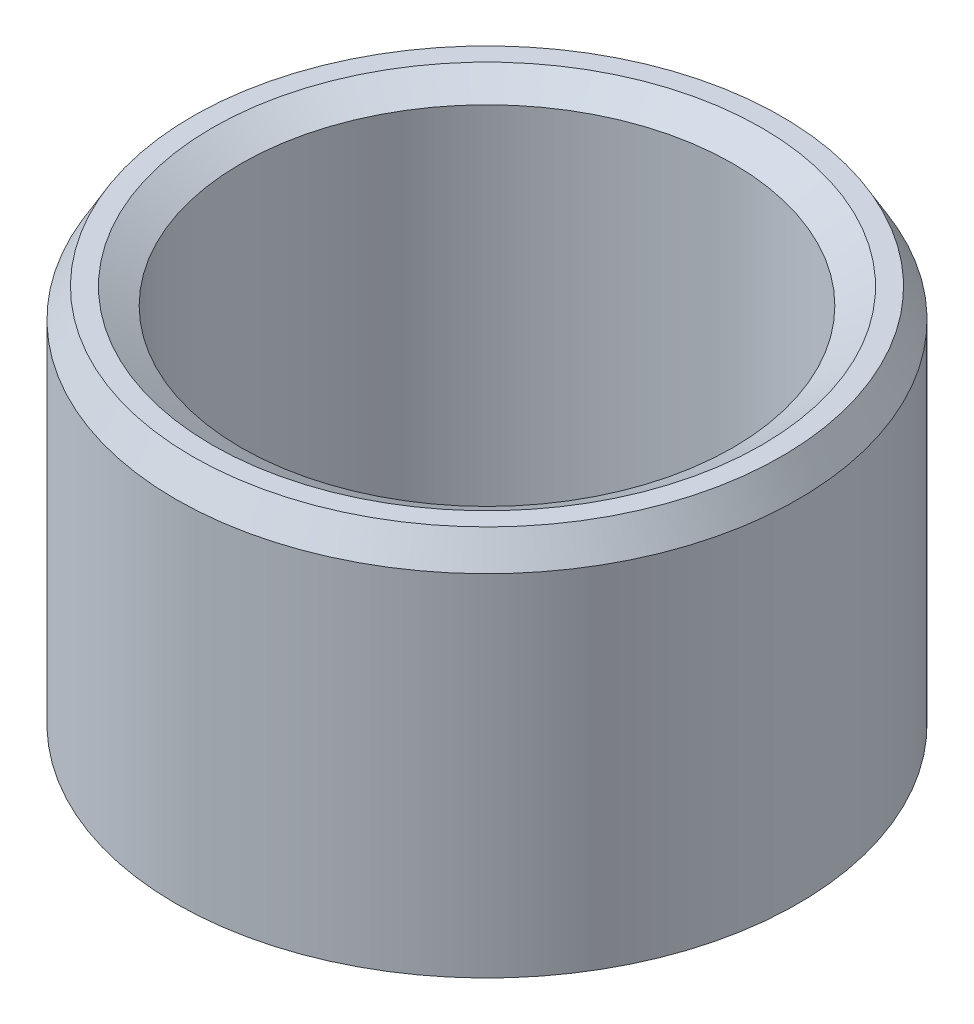
from build123d import *
from OCP.BRepFilletAPI import BRepFilletAPI_MakeChamfer

# Parameters (mm, degrees)
SKETCH1_R           = 25
BOSS_EXTRUDE1_DEPTH = 31.775701494
SKETCH2_R           = 19.76146242
CUT_EXTRUDE1_DEPTH  = 48.536251487
CHAMFER1_SIZE       = 2.312015077
CHAMFER1_SIZE2      = 1.334842527


with BuildPart() as part:
    # Sketch1 → Boss-Extrude1 (new body)
    with BuildSketch(Plane(origin=(0, 0, 0), x_dir=(1, 0, 0), z_dir=(0, 1, 0))):
        Circle(SKETCH1_R)
    extrude(amount=BOSS_EXTRUDE1_DEPTH)

    # Sketch2 → Cut-Extrude1 (cut, through all)
    with BuildSketch(Plane(origin=(0, 0, 0), x_dir=(1, 0, 0), z_dir=(0, 1, 0))):
        Circle(SKETCH2_R)
    extrude(amount=CUT_EXTRUDE1_DEPTH, mode=Mode.SUBTRACT)

    # Chamfer1: one chamfer whose edges measure the first distance from different faces: ONE call of the kernel's chamfer builder (chamfer() names one face for all edges)
    chamfer1_edges_1 = [part.edges().sort_by_distance(p)[0] for p in [
        (-19.76146242, 31.775701494, 0),
    ]]
    chamfer1_side_1 = [part.faces().sort_by_distance(p)[0] for p in [
        (-24.292893219, 31.775701494, 0),
    ]]
    chamfer1_edges_2 = [part.edges().sort_by_distance(p)[0] for p in [
        (-19.76146242, 0, 0),
    ]]
    chamfer1_side_2 = [part.faces().sort_by_distance(p)[0] for p in [
        (-19.76146242, 15.887850747, 0),
    ]]
    chamfer1_edges_3 = [part.edges().sort_by_distance(p)[0] for p in [
        (-25, 0, 0),
    ]]
    chamfer1_side_3 = [part.faces().sort_by_distance(p)[0] for p in [
        (-24.292893219, 0, 0),
    ]]
    chamfer1_edges_4 = [part.edges().sort_by_distance(p)[0] for p in [
        (-25, 31.775701494, 0),
    ]]
    chamfer1_side_4 = [part.faces().sort_by_distance(p)[0] for p in [
        (-25, 15.887850747, 0),
    ]]
    chamfer1 = BRepFilletAPI_MakeChamfer(part.part.solid().wrapped)
    for e in chamfer1_edges_1:
        chamfer1.Add(CHAMFER1_SIZE, CHAMFER1_SIZE2, e.wrapped, chamfer1_side_1[0].wrapped)  # the first distance lies on this face
    for e in chamfer1_edges_2:
        chamfer1.Add(CHAMFER1_SIZE, CHAMFER1_SIZE2, e.wrapped, chamfer1_side_2[0].wrapped)  # the first distance lies on this face
    for e in chamfer1_edges_3:
        chamfer1.Add(CHAMFER1_SIZE, CHAMFER1_SIZE2, e.wrapped, chamfer1_side_3[0].wrapped)  # the first distance lies on this face
    for e in chamfer1_edges_4:
        chamfer1.Add(CHAMFER1_SIZE, CHAMFER1_SIZE2, e.wrapped, chamfer1_side_4[0].wrapped)  # the first distance lies on this face
    add(Compound.cast(chamfer1.Shape()), mode=Mode.REPLACE)


solid = part.part
